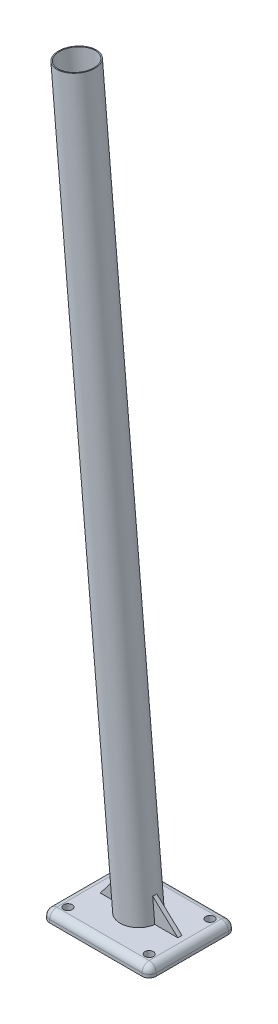
from build123d import *

# Parameters (mm, degrees)
SKETCH1_W                       = 105
SKETCH1_H                       = 85
SKETCH1_R                       = 4.2
BOSS_EXTRUDE1_DEPTH             = 10
SKETCH14_R                      = 18
SKETCH14_R_2                    = 17
BOSS_EXTRUDE4_DEPTH             = 700
BOSS_EXTRUDE4_DIRECTION_2_REACH = 70.283
RIB2_REACH                      = 716.562
SKETCH21_WALL_W                 = 1464.864259786
SKETCH21_WALL_H                 = 4
RIB5_REACH                      = 716.562
SKETCH22_WALL_W                 = 1457.169117376
SKETCH22_WALL_H                 = 4
FILLET1_R                       = 7
FILLET2_R                       = 7
CUT_EXTRUDE1_REACH              = 717.102
CUT_EXTRUDE1_END_RADIUS         = 17
SKETCH26_R                      = 4.1


with BuildPart() as part:
    # Sketch1 → Boss-Extrude1 (new body)
    with BuildSketch(Plane(origin=(0, 0, 0), x_dir=(1, 0, 0), z_dir=(0, 1, 0))):
        Rectangle(SKETCH1_W, SKETCH1_H)
        with Locations(Location((-40, -30, 0), (0, 0, 270))):
            Circle(SKETCH1_R, mode=Mode.SUBTRACT)
        with Locations(Location((40, 30, 0), (0, 0, 270))):
            Circle(SKETCH1_R, mode=Mode.SUBTRACT)
        with Locations(Location((40, -30, 0), (0, 0, 270))):
            Circle(SKETCH1_R, mode=Mode.SUBTRACT)
        with Locations(Location((-40, 30, 0), (0, 0, 270))):
            Circle(SKETCH1_R, mode=Mode.SUBTRACT)
    extrude(amount=BOSS_EXTRUDE1_DEPTH)

    # Sketch14 → Boss-Extrude4 (add)
    with BuildSketch(Plane(origin=(0, 10, 0), x_dir=(-0.9961946980917459, -0.08715574274765506, 0), z_dir=(0.08715574274765506, -0.9961946980917459, 0))):
        with Locations((0.435778714, 0)):
            Circle(SKETCH14_R)
        with Locations((0.435778714, 0)):
            Circle(SKETCH14_R_2, mode=Mode.SUBTRACT)
    extrude(amount=-BOSS_EXTRUDE4_DEPTH)

    # Boss-Extrude4 direction 2: up to this face of the body (flat: up to its plane)
    boss_extrude4_direction_2_end = Plane(part.part.faces().sort_by_distance((0, 10, 0))[0])
    # Sketch14 → Boss-Extrude4 direction 2 (add, up to the picked face)
    with BuildSketch(Plane(origin=(0, 10, 0), x_dir=(-0.9961946980917459, -0.08715574274765506, 0), z_dir=(0.08715574274765506, -0.9961946980917459, 0)), mode=Mode.PRIVATE) as boss_extrude4_direction_2_sk1:
        with Locations((0.435778714, 0)):
            Circle(SKETCH14_R)
        with Locations((0.435778714, 0)):
            Circle(SKETCH14_R_2, mode=Mode.SUBTRACT)
    boss_extrude4_direction_2_tool1 = split(extrude(boss_extrude4_direction_2_sk1.sketch, amount=BOSS_EXTRUDE4_DIRECTION_2_REACH, mode=Mode.PRIVATE), bisect_by=boss_extrude4_direction_2_end, keep=Keep.BOTH, mode=Mode.PRIVATE)
    add(boss_extrude4_direction_2_tool1.solids().sort_by(Axis((16.990205, 11.48645, 0), (0.08715574274765506, -0.9961946980917459, 0)))[0])

    # Sketch21 wall → Rib2 (add, up to next)
    with BuildSketch(Plane(origin=(27.942090865, 21.517823641, 0), x_dir=(0.730658017889, -0.682743627502, 0), z_dir=(0.682743627502, 0.730658017889, 0)), mode=Mode.PRIVATE) as rib2_sk1:
        Rectangle(SKETCH21_WALL_W, SKETCH21_WALL_H)
    rib2_tool1 = extrude(rib2_sk1.sketch, amount=-RIB2_REACH, mode=Mode.PRIVATE) - part.part
    add(rib2_tool1.solids().sort_by_distance((27.942090865, 21.517823641, 0))[0])

    # Sketch22 wall → Rib5 (add, up to next)
    with BuildSketch(Plane(origin=(-28.227154914, 20.343956887, 0), x_dir=(-0.607494293968, -0.794324041432, 0), z_dir=(0.794324041432, -0.607494293968, 0)), mode=Mode.PRIVATE) as rib5_sk1:
        Rectangle(SKETCH22_WALL_W, SKETCH22_WALL_H)
    rib5_tool1 = extrude(rib5_sk1.sketch, amount=RIB5_REACH, mode=Mode.PRIVATE) - part.part
    add(rib5_tool1.solids().sort_by_distance((-28.227154914, 20.343956887, 0))[0])

    # Fillet1
    fillet1_edges = [part.edges().sort_by_distance(p)[0] for p in [
        (52.5, 10, 0),
        (-52.5, 10, 0),
        (52.5, 5, 42.5),
        (-52.5, 5, 42.5),
    ]]
    fillet(fillet1_edges, radius=FILLET1_R)

    # Fillet2
    # the kernel refuses this fillet: 7 mm, written as the material it takes off along each edge
    with BuildSketch(Plane(origin=(45.5, 3, 35.5), x_dir=(0, 1, 0), z_dir=(0, 0, 1))) as fillet2_piece_1_section:
        Polygon((0, 0), (FILLET2_R, 0), (FILLET2_R, -FILLET2_R), (0, -FILLET2_R), align=None)
    fillet2_piece_1 = extrude(amount=FILLET2_R, mode=Mode.PRIVATE)
    fillet2_piece_1 = fillet2_piece_1 - Plane(origin=(45.5, 3, 35.5), x_dir=(-0.7071067811865475, -0.7071067811865475, 0), z_dir=(0, 0, 1)) * Sphere(FILLET2_R, mode=Mode.PRIVATE)
    add(fillet2_piece_1, mode=Mode.SUBTRACT)
    with BuildSketch(Plane(origin=(-45.5, 3, 35.5), x_dir=(0, 1, 0), z_dir=(0, 0, 1))) as fillet2_piece_2_section:
        Polygon((0, 0), (FILLET2_R, 0), (FILLET2_R, FILLET2_R), (0, FILLET2_R), align=None)
    fillet2_piece_2 = extrude(amount=FILLET2_R, mode=Mode.PRIVATE)
    fillet2_piece_2 = fillet2_piece_2 - Plane(origin=(-45.5, 3, 35.5), x_dir=(0.7071067811865475, -0.7071067811865475, 0), z_dir=(0, 0, 1)) * Sphere(FILLET2_R, mode=Mode.PRIVATE)
    add(fillet2_piece_2, mode=Mode.SUBTRACT)
    with BuildSketch(Plane(origin=(-45.5, 10, -42.5), x_dir=(0, 0, 1), z_dir=(1, 0, 0))) as fillet2_piece_3:
        with BuildLine():
            CenterArc((FILLET2_R, FILLET2_R), FILLET2_R, 180, 90)
            Line((0, FILLET2_R), (0, 0))
            Line((0, 0), (FILLET2_R, 0))
        make_face()
    extrude(amount=91, mode=Mode.SUBTRACT)
    with BuildSketch(Plane(origin=(45.5, 10, 42.5), x_dir=(0, -1, 0), z_dir=(-1, 0, 0))) as fillet2_piece_4:
        with BuildLine():
            CenterArc((FILLET2_R, -FILLET2_R), FILLET2_R, 90, 90)
            Line((0, -FILLET2_R), (0, 0))
            Line((0, 0), (FILLET2_R, 0))
        make_face()
    extrude(amount=91, mode=Mode.SUBTRACT)
    with BuildSketch(Plane(origin=(-52.5, -17.5, -42.5), x_dir=(0, 0, 1), z_dir=(0, 1, 0))) as fillet2_piece_5:
        with BuildLine():
            CenterArc((FILLET2_R, FILLET2_R), FILLET2_R, 180, 90)
            Line((0, FILLET2_R), (0, 0))
            Line((0, 0), (FILLET2_R, 0))
        make_face()
    extrude(amount=20.5, mode=Mode.SUBTRACT)
    with BuildSketch(Plane(origin=(52.5, -17.5, -42.5), x_dir=(0, 0, 1), z_dir=(0, 1, 0))) as fillet2_piece_6:
        with BuildLine():
            CenterArc((FILLET2_R, -FILLET2_R), FILLET2_R, 90, 90)
            Line((0, -FILLET2_R), (0, 0))
            Line((0, 0), (FILLET2_R, 0))
        make_face()
    extrude(amount=20.5, mode=Mode.SUBTRACT)
    with BuildSketch(Plane(origin=(-45.5, 3, -42.5), x_dir=(-1, 0, 0), z_dir=(0, -1, 0))) as fillet2_piece_7:
        with BuildLine():
            CenterArc((7 - FILLET2_R, -FILLET2_R), FILLET2_R, 0, 90)
            Line((7, -FILLET2_R), (7, 0))
            Line((7, 0), (7 - FILLET2_R, 0))
        make_face()
    revolve(axis=Axis((-45.5, 3, -42.5), (0, 0, -1)), revolution_arc=90, mode=Mode.SUBTRACT)
    with BuildSketch(Plane(origin=(45.5, 3, -42.5), x_dir=(1, 0, 0), z_dir=(0, -1, 0))) as fillet2_piece_8:
        with BuildLine():
            CenterArc((7 - FILLET2_R, FILLET2_R), FILLET2_R, 270, 90)
            Line((7, FILLET2_R), (7, 0))
            Line((7, 0), (7 - FILLET2_R, 0))
        make_face()
    revolve(axis=Axis((45.5, 3, -42.5), (0, 0, 1)), revolution_arc=90, mode=Mode.SUBTRACT)

    # Cut-Extrude1: up to this cylinder (the profile starts outside it)
    cut_extrude1_end = Plane(origin=(-57.085353251, 657.488573385, 0), z_dir=(-0.08715574274765504, 0.9961946980917459, 0)) * Cylinder(CUT_EXTRUDE1_END_RADIUS, 1469.204, mode=Mode.PRIVATE)
    # Sketch26 → Cut-Extrude1 (cut, up to the surface)
    with BuildSketch(Plane(origin=(-17.497384121, -1.530822752, 0), x_dir=(0, 0, 1), z_dir=(-0.9961946980917459, -0.08715574274765504, 0)), mode=Mode.PRIVATE) as cut_extrude1_sk1:
        with Locations(Location((0, 659.961946981, 0), (0, 0, 270))):
            Circle(SKETCH26_R)
    cut_extrude1_tool1 = extrude(cut_extrude1_sk1.sketch, amount=-CUT_EXTRUDE1_REACH, mode=Mode.PRIVATE) - cut_extrude1_end
    add(cut_extrude1_tool1.solids().sort_by_distance((-75.016858, 655.91977, 0))[0], mode=Mode.SUBTRACT)


solid = part.part
